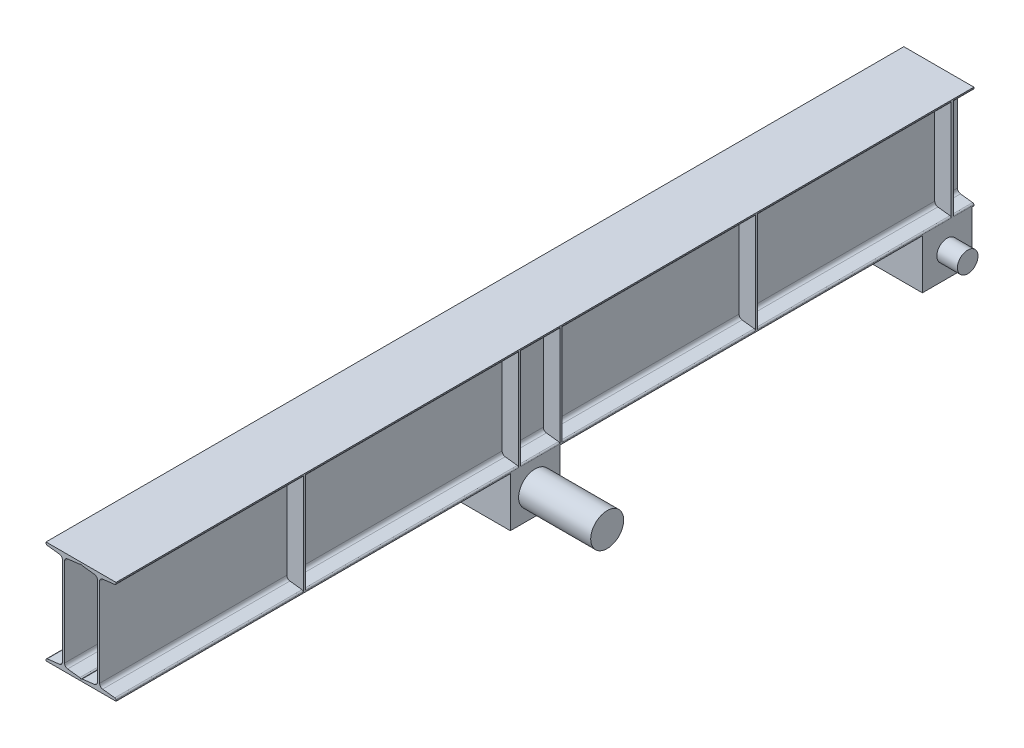
from build123d import *

# Parameters (mm, degrees)
EXTRUDE_1136_DEPTH     = 4164
EXTRUDE_1_REACH        = 4199.356
SKETCH_1191_W          = 10
SKETCH_1191_H          = 490.598199432
PATTERN_LINEAR_1_COUNT = 3
PATTERN_LINEAR_1_PITCH = 950
PATTERN_LINEAR_2_COUNT = 2
PATTERN_LINEAR_2_PITCH = 2100
PATTERN_LINEAR_3_COUNT = 2
PATTERN_LINEAR_3_PITCH = 3145
SKETCH_1597_W          = 170
SKETCH_1597_H          = 240
EXTRUDE_1746_DEPTH     = 240
SKETCH_1801_R          = 80
EXTRUDE_2316_DEPTH     = 350
SKETCH_2358_W          = 170
SKETCH_2358_H          = 240
EXTRUDE_2517_DEPTH     = 240
SKETCH_2569_R          = 50
EXTRUDE_3116_DEPTH     = 100


# Read off the part's stored shape, not the designer's step: Дзеркальне відображення
with BuildPart() as part:
    # Sketch 696 → Extrude 1136 (new body)
    with BuildSketch(Plane.XY):
        with BuildLine():
            Line((5, 464.372813925), (5, 35.627186075))
            ThreePointArc((5, 35.627186075), (9.279999452, 24.348818017), (19.964892476, 18.749439265))
            Line((19.964892476, 18.749439265), (78.837985451, 11.650560735))
            ThreePointArc((78.837985451, 11.650560735), (83.237647285, 9.34493419), (85, 4.700900284))
            Line((85, 4.700900284), (85, 0))
            Line((85, 0), (-85, 0))
            Line((-85, 0), (-85, 4.700900284))
            ThreePointArc((-85, 4.700900284), (-83.237647285, 9.34493419), (-78.837985451, 11.650560735))
            Line((-78.837985451, 11.650560735), (-19.964892476, 18.749439265))
            ThreePointArc((-19.964892476, 18.749439265), (-9.279999452, 24.348818017), (-5, 35.627186075))
            Line((-5, 35.627186075), (-5, 464.372813925))
            ThreePointArc((-5, 464.372813925), (-9.279999452, 475.651181983), (-19.964892476, 481.250560735))
            Line((-19.964892476, 481.250560735), (-78.837985451, 488.349439265))
            ThreePointArc((-78.837985451, 488.349439265), (-83.237647285, 490.65506581), (-85, 495.299099716))
            Line((-85, 495.299099716), (-85, 500))
            Line((-85, 500), (85, 500))
            Line((85, 500), (85, 495.299099716))
            ThreePointArc((85, 495.299099716), (83.237647285, 490.65506581), (78.837985451, 488.349439265))
            Line((78.837985451, 488.349439265), (19.964892476, 481.250560735))
            ThreePointArc((19.964892476, 481.250560735), (9.279999452, 475.651181983), (5, 464.372813925))
        make_face()
    extrude(amount=EXTRUDE_1136_DEPTH)

    # Ребро1: up to this face of the body (flat: up to its plane)
    extrude_1_end = Plane(part.part.faces().sort_by_distance((5, 250, 2082))[0])
    # Sketch 1191 → Ребро1 (add, up to the picked face)
    with BuildSketch(Plane(origin=(85, 0, 0), x_dir=(0, 0, -1), z_dir=(1, 0, 0)), mode=Mode.PRIVATE) as extrude_1_sk1:
        with Locations((-105, 250)):
            Rectangle(SKETCH_1191_W, SKETCH_1191_H)
    extrude_1_tool1 = split(extrude(extrude_1_sk1.sketch, amount=-EXTRUDE_1_REACH, mode=Mode.PRIVATE), bisect_by=extrude_1_end, keep=Keep.BOTH, mode=Mode.PRIVATE)
    extrude_1 = extrude_1_tool1.solids().sort_by(Axis((85, 250, 105), (-1, 0, 0)))[0]
    add(extrude_1)

    # Масив ребер1: Ребро1 ×3
    with Locations(*[(0, 0, i * PATTERN_LINEAR_1_PITCH) for i in range(1, PATTERN_LINEAR_1_COUNT)]):
        add(extrude_1)

    # Масив ребер2: Ребро1 ×2
    with Locations(*[(0, 0, i * PATTERN_LINEAR_2_PITCH) for i in range(1, PATTERN_LINEAR_2_COUNT)]):
        add(extrude_1)

    # Масив ребер3: Ребро1 ×2
    with Locations(*[(0, 0, i * PATTERN_LINEAR_3_PITCH) for i in range(1, PATTERN_LINEAR_3_COUNT)]):
        add(extrude_1)

    # Sketch 1597 → Extrude 1746 (add)
    with BuildSketch(Plane.XZ):
        with Locations((0, 2130)):
            Rectangle(SKETCH_1597_W, SKETCH_1597_H)
    extrude(amount=EXTRUDE_1746_DEPTH)

    # Sketch 1801 → Extrude 2316 (add)
    with BuildSketch(Plane(origin=(85, 0, 0), x_dir=(0, 0, -1), z_dir=(1, 0, 0))):
        with Locations(Location((-2130, -120, 0), (0, 0, 180))):
            Circle(SKETCH_1801_R)
    extrude(amount=EXTRUDE_2316_DEPTH)

    # Sketch 2358 → Extrude 2517 (add)
    with BuildSketch(Plane.XZ):
        with Locations((0, 130)):
            Rectangle(SKETCH_2358_W, SKETCH_2358_H)
    extrude(amount=EXTRUDE_2517_DEPTH)

    # Sketch 2569 → Extrude 3116 (add)
    with BuildSketch(Plane(origin=(85, 0, 0), x_dir=(0, 0, -1), z_dir=(1, 0, 0))):
        with Locations(Location((-130, -120, 0), (0, 0, 180))):
            Circle(SKETCH_2569_R)
    extrude(amount=EXTRUDE_3116_DEPTH)

    # Mirror 3159: part across plane


with BuildPart() as part_1:
    add(part.part)
    add(part.part.mirror(Plane(origin=(-85, 4.700900284, 4164), x_dir=(0, 0, 1), z_dir=(1, 0, 0))))


solid = part_1.part
